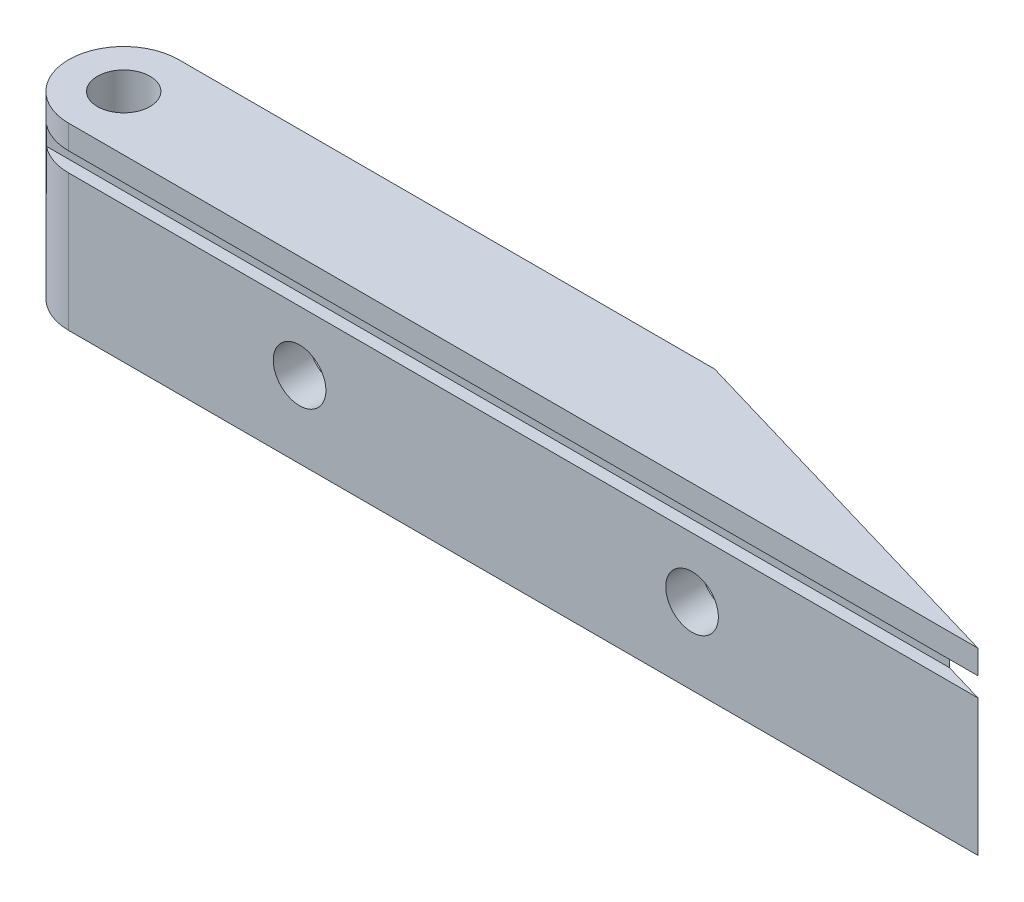
from build123d import *

# Parameters (mm, degrees)
SKETCH3_R           = 1.1
BOSS_EXTRUDE1_DEPTH = 7.5
SHELL1_START        = 0.5
SHELL1_OUTLINE_R    = 1.6
SHELL1_DEPTH        = 6.5
SKETCH5_W           = 36.304347826
SKETCH5_H           = 6.5
BOSS_EXTRUDE2_DEPTH = 1
CUT_EXTRUDE2_DEPTH  = 24.369518609
SKETCH7_R           = 1.1
CUT_EXTRUDE3_DEPTH  = 24.524123788
SKETCH10_W          = 87.275560702
SKETCH10_H          = 0.8
CUT_EXTRUDE15_DEPTH = 0.499
SKETCH11_R          = 1.1
CUT_EXTRUDE16_DEPTH = 24.805553974


# Read off the part's stored shape, not the designer's step: Shell1
with BuildPart() as part:
    # Sketch3 → Boss-Extrude1 (new body)
    with BuildSketch(Plane(origin=(0, 0, 0), x_dir=(1, 0, 0), z_dir=(0, 1, 0))):
        with BuildLine():
            Line((-15.88, 2.8), (6.52, 2.8))
            Line((6.52, 2.8), (22.12, -1.8))
            Line((22.12, -1.8), (-15.88, -1.8))
            ThreePointArc((-15.88, -1.8), (-18.18, 0.5), (-15.88, 2.8))
        make_face()
        with Locations(Location((-15.88, 0.5, 0), (0, 0, 270))):
            Circle(SKETCH3_R, mode=Mode.SUBTRACT)
    extrude(amount=BOSS_EXTRUDE1_DEPTH)

    # Shell1 outline → Shell1 (cut)
    with BuildSketch(Plane(origin=(0, 0, 0), x_dir=(1, 0, 0), z_dir=(0, 1, 0)).offset(SHELL1_START)):
        with BuildLine():
            Line((6.52, 2.8), (-15.88, 2.8))
            Line((-15.88, 2.8), (-15.88, 2.3))
            ThreePointArc((-15.88, 2.3), (-17.68, 0.5), (-15.88, -1.3))
            Line((-15.88, -1.3), (20.424347826, -1.3))
            Line((20.424347826, -1.3), (6.52, 2.8))
        make_face()
        with Locations((-15.88, 0.5)):
            Circle(SHELL1_OUTLINE_R, mode=Mode.SUBTRACT)
    extrude(amount=SHELL1_DEPTH, mode=Mode.SUBTRACT)

    # Sketch5 → Boss-Extrude2 (add)
    with BuildSketch(Plane(origin=(0, 0, 1.3), x_dir=(-1, 0, 0), z_dir=(0, 0, -1))):
        with Locations((-2.272173913, 3.75)):
            Rectangle(SKETCH5_W, SKETCH5_H)
    extrude(amount=BOSS_EXTRUDE2_DEPTH)

    # Sketch6 → Cut-Extrude2 (cut, through all)
    with BuildSketch(Plane(origin=(0, 7, 0), x_dir=(1, 0, 0), z_dir=(0, 1, 0))):
        Polygon((20.424347826, -0.3), (17.033043478, -0.3), (20.424347826, -1.3), align=None)
    extrude(amount=-CUT_EXTRUDE2_DEPTH, mode=Mode.SUBTRACT)

    # Sketch7 → Cut-Extrude3 (cut, through all)
    with BuildSketch(Plane(origin=(0, 7.5, 0), x_dir=(1, 0, 0), z_dir=(0, 1, 0))):
        with Locations(Location((-15.88, 0.5, 0), (0, 0, 270))):
            Circle(SKETCH7_R)
    extrude(amount=-CUT_EXTRUDE3_DEPTH, mode=Mode.SUBTRACT)

    # Sketch10 → Cut-Extrude15 (cut)
    with BuildSketch(Plane.XY.offset(1.8)):
        with Locations((23.190230884, 6.1)):
            Rectangle(SKETCH10_W, SKETCH10_H)
    extrude(amount=-CUT_EXTRUDE15_DEPTH, mode=Mode.SUBTRACT)

    # Sketch11 → Cut-Extrude16 (cut, through all)
    with BuildSketch(Plane.XY.offset(1.8)):
        with Locations((-6.23, 3.2)):
            Circle(SKETCH11_R)
        with Locations((10.1714, 3.2)):
            Circle(SKETCH11_R)
    extrude(amount=-CUT_EXTRUDE16_DEPTH, mode=Mode.SUBTRACT)


solid = part.part
